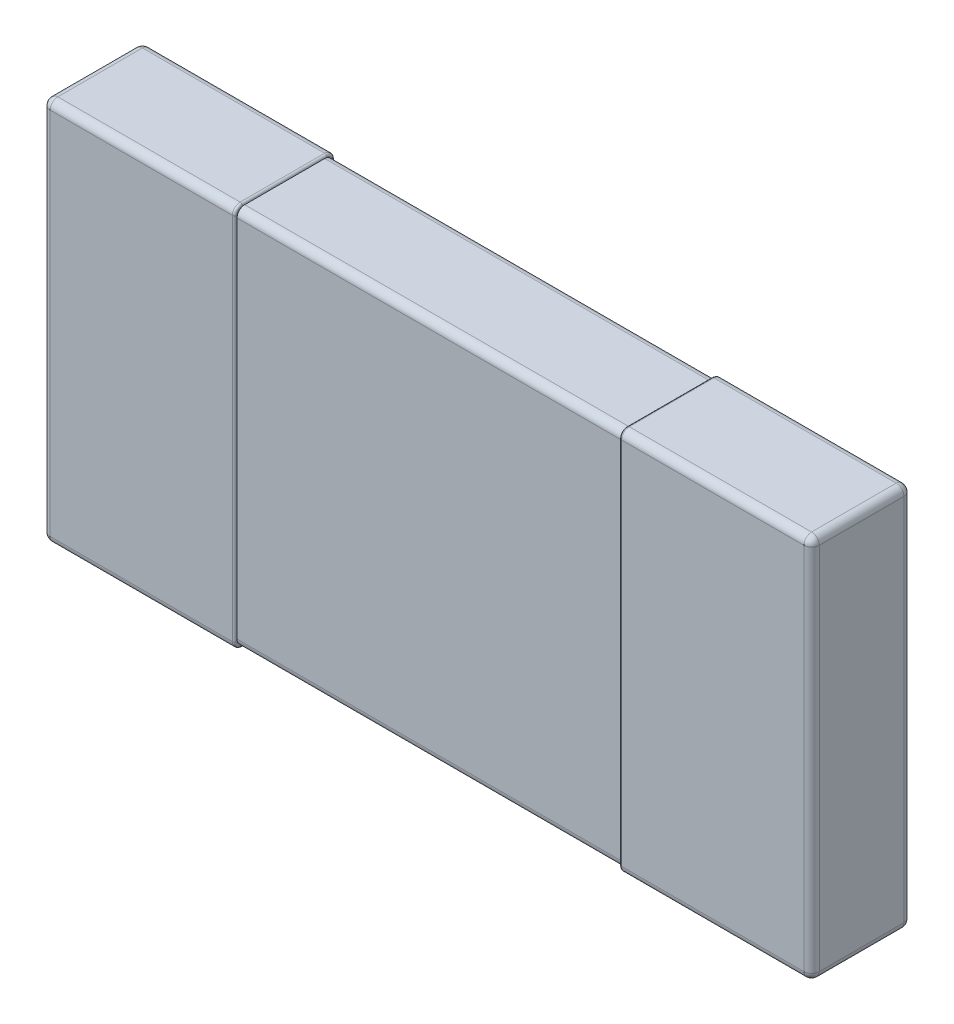
from build123d import *

# Parameters (mm, degrees)
SKETCH1_W                           = 1
SKETCH1_H                           = 0.5
ALL_BODY_DEPTH                      = 0.13
CUT_OUT_THE_BODY_FOR_PIN_DEPTH      = 0.25
CUT_OUT_THE_BODY_FOR_PIN_DEPTH_BACK = 0.25
SKETCH2_OUTSIDE_W                   = 2.356
SKETCH2_OUTSIDE_H                   = 2.726
SKETCH2_OUTSIDE_W_2                 = 0.124
SKETCH2_OUTSIDE_H_2                 = 0.494
BODY_FILLET_R                       = 0.01
PIN_FILLET_A_R                      = 0.01
PIN_FILLET_B_R                      = 0.003


with BuildPart() as part:
    # Sketch1 → All body (new body)
    with BuildSketch(Plane.XY):
        Rectangle(SKETCH1_W, SKETCH1_H)
    extrude(amount=ALL_BODY_DEPTH)

    # Sketch2 outside → Cut out the body for pin (cut, two sides: drawn at the far end of the back side and taken through both)
    with BuildSketch(Plane(origin=(0, 0, 0), x_dir=(0, 0, -1), z_dir=(1, 0, 0)).offset(-CUT_OUT_THE_BODY_FOR_PIN_DEPTH_BACK)):
        with Locations((-0.065, 0)):
            Rectangle(SKETCH2_OUTSIDE_W, SKETCH2_OUTSIDE_H)
        with Locations((-0.065, 0)):
            Rectangle(SKETCH2_OUTSIDE_W_2, SKETCH2_OUTSIDE_H_2, mode=Mode.SUBTRACT)
    extrude(amount=CUT_OUT_THE_BODY_FOR_PIN_DEPTH + CUT_OUT_THE_BODY_FOR_PIN_DEPTH_BACK, mode=Mode.SUBTRACT)

    # Body fillet
    body_fillet_edges = [part.edges().sort_by_distance(p)[0] for p in [
        (0, 0.247, 0.003),
        (0, 0.247, 0.127),
        (0, -0.247, 0.127),
        (0, -0.247, 0.003),
    ]]
    fillet(body_fillet_edges, radius=BODY_FILLET_R)

    # Pin fillet a
    pin_fillet_a_edges = [part.edges().sort_by_distance(p)[0] for p in [
        (0.5, 0, 0.13),
        (-0.375, 0.25, 0),
        (0.375, -0.25, 0),
        (0.375, -0.25, 0.13),
        (-0.375, 0.25, 0.13),
        (0.375, 0.25, 0.13),
        (-0.5, 0, 0.13),
        (0.375, 0.25, 0),
        (0.5, 0, 0),
        (-0.375, -0.25, 0),
        (-0.5, 0, 0),
        (-0.5, 0.25, 0.065),
        (0.5, 0.25, 0.065),
        (0.5, -0.25, 0.065),
        (-0.5, -0.25, 0.065),
        (-0.375, -0.25, 0.13),
    ]]
    fillet(pin_fillet_a_edges, radius=PIN_FILLET_A_R)

    # Pin fillet b
    pin_fillet_b_edges = [part.edges().sort_by_distance(p)[0] for p in [
        (0.25, -0.25, 0.065),
        (0.25, 0, 0.13),
        (0.25, 0.25, 0.065),
        (0.25, 0, 0),
        (-0.25, 0.25, 0.065),
        (-0.25, 0, 0.13),
        (-0.25, -0.25, 0.065),
        (-0.25, 0, 0),
        (0.25, 0.247071068, 0.002928932),
        (0.25, -0.247071068, 0.002928932),
        (0.25, -0.247071068, 0.127071068),
        (0.25, 0.247071068, 0.127071068),
        (-0.25, -0.247071068, 0.127071068),
        (-0.25, 0.247071068, 0.127071068),
        (-0.25, -0.247071068, 0.002928932),
        (-0.25, 0.247071068, 0.002928932),
    ]]
    fillet(pin_fillet_b_edges, radius=PIN_FILLET_B_R - 0.0001)  # a hair under: the kernel refuses the full size


solid = part.part
